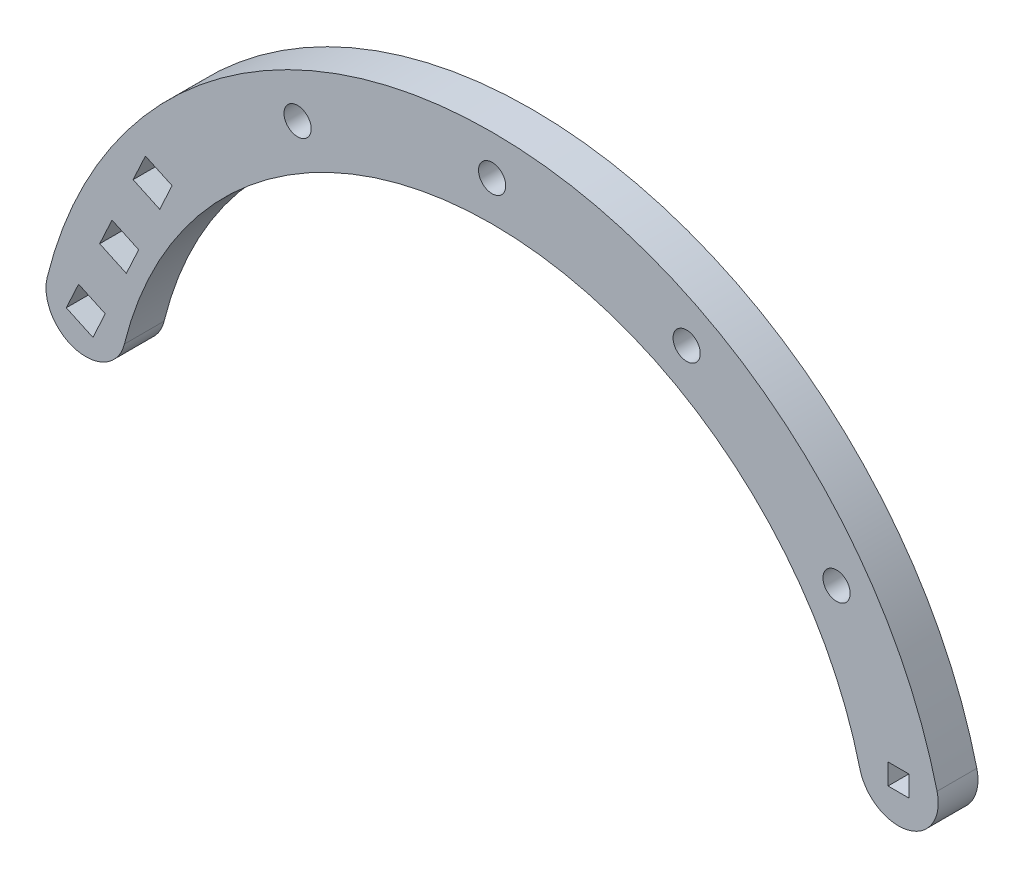
from build123d import *

# Parameters (mm, degrees)
SKETCH2_W           = 3.3274
SKETCH2_H           = 3.3274
BOSS_EXTRUDE1_DEPTH = 6.35
SKETCH5_R           = 2.1717
CUT_EXTRUDE1_DEPTH  = 25.4


with BuildPart() as part:
    # Sketch2 → Boss-Extrude1 (new body)
    with BuildSketch(Plane.XY):
        with BuildLine():
            ThreePointArc((135.933103671, 1.523612314), (64.8843, 57.15), (-6.164503671, 1.523612314))
            ThreePointArc((-6.164503671, 1.523612314), (-1.523612314, -6.164503671), (6.164503671, -1.523612314))
            ThreePointArc((6.164503671, -1.523612314), (64.8843, 44.45), (123.604096329, -1.523612314))
            ThreePointArc((123.604096329, -1.523612314), (131.292212314, -6.164503671), (135.933103671, 1.523612314))
        make_face()
        Polygon((-1.142495341, 3.111345083), (3.111345083, 1.142495341), (1.142495341, -3.111345083), (-3.111345083, -1.142495341), align=None, mode=Mode.SUBTRACT)
        with Locations((129.7686, 0)):
            Rectangle(SKETCH2_W, SKETCH2_H, mode=Mode.SUBTRACT)
        Polygon((4.191911882, 14.636713109), (2.223061999, 10.38287238), (6.476902727, 8.414022496), (8.445752611, 12.667863225), align=None, mode=Mode.SUBTRACT)
        Polygon((9.526319716, 26.162080852), (7.55746908, 21.9082401), (11.811310114, 19.939390075), (13.780159857, 24.193230498), align=None, mode=Mode.SUBTRACT)
    extrude(amount=BOSS_EXTRUDE1_DEPTH)

    # Sketch5 → Cut-Extrude1 (cut)
    with BuildSketch(Plane(origin=(0, 0, 0), x_dir=(-1, 0, 0), z_dir=(0, 0, -1))):
        with Locations((-64.8843, 50.8)):
            Circle(SKETCH5_R)
        with Locations((-33.823719996, 43.144254616)):
            Circle(SKETCH5_R)
        with Locations((-119.889855449, 21.93085747)):
            Circle(SKETCH5_R)
        with Locations((-95.944880004, 43.144254616)):
            Circle(SKETCH5_R)
    extrude(amount=-CUT_EXTRUDE1_DEPTH, mode=Mode.SUBTRACT)


solid = part.part
